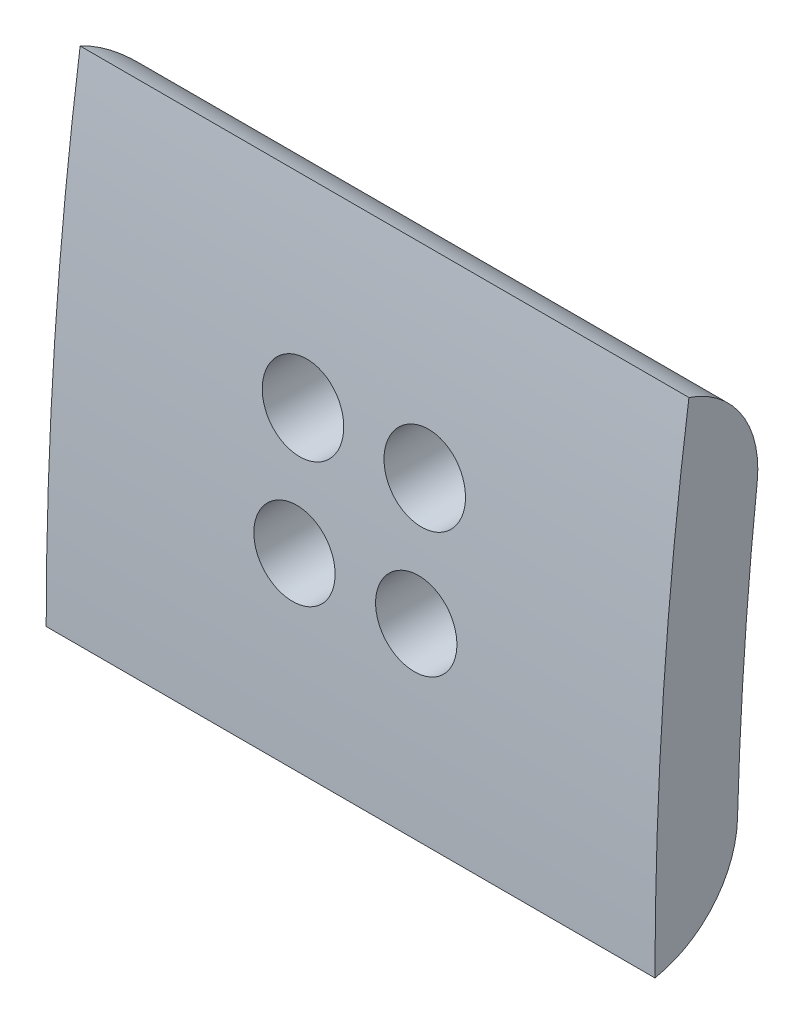
from build123d import *

# Parameters (mm, degrees)
SALIENTE_EXTRUIR1_DEPTH = 30
REDONDEO1_R             = 5
CROQUIS2_R              = 2
CORTAR_EXTRUIR1_DEPTH   = 41.197257902


with BuildPart() as part:
    # Croquis1 → Saliente-Extruir1 (new body)
    with BuildSketch(Plane(origin=(0, 0, 0), x_dir=(0, 0, -1), z_dir=(1, 0, 0))):
        with BuildLine():
            Line((-172, 0), (-168, 0))
            ThreePointArc((-168, 0), (-167.590760444, 11.719087589), (-166.365035549, 23.381080961))
            Line((-166.365035549, 23.381080961), (-170.326107824, 23.937773365))
            ThreePointArc((-170.326107824, 23.937773365), (-171.581016645, 11.998113484), (-172, 0))
        make_face()
    extrude(amount=SALIENTE_EXTRUIR1_DEPTH)

    # Redondeo1
    # the kernel refuses this fillet: 5 mm, written as the material it takes off along each edge
    with BuildSketch(Plane(origin=(-11.928000159, 0, 168), x_dir=(0, 0, 1), z_dir=(1, 0, 0))) as redondeo1_piece_1:
        with BuildLine():
            CenterArc((4.930232558, -4.912704692), REDONDEO1_R, 100.722152416, 77.650592735)
            Line((-0.067751042, -4.770719007), (-0.167710714, -4.767879293))
            ThreePointArc((-0.167710714, -4.767879293), (-0.116928532, -2.384180032), (-0.1, 0))
            Line((-0.1, 0), (0, 0.1))
            ThreePointArc((0, 0.1), (2, 0.1), (3.981395349, 0.098254094))
            Line((3.981395349, 0.098254094), (4, 0))
        make_face()
    redondeo1_piece_1_solid = extrude(amount=53.856000318, mode=Mode.PRIVATE)
    with BuildSketch(Plane(origin=(0, 0, 0), x_dir=(0, -0.07283715429145175, 0.9973438469027236), z_dir=(0, -0.9973438469027236, -0.07283715429145175))) as redondeo1_piece_2:
        with BuildLine():
            CenterArc((173, -4.898979486), REDONDEO1_R, 101.536959033, 78.463040967)
            Line((172, 0), (171.98, 0.09797959))
            ThreePointArc((171.98, 0.09797959), (170, 0.1), (168, 0.1))
            Line((168, 0.1), (167.9, 0))
            Line((167.9, 0), (167.9, -4.898979486))
            Line((167.9, -4.898979486), (168, -4.898979486))
        make_face()
    redondeo1_piece_2_solid = revolve(axis=Axis((0, 0, 0), (-1, 0, 0)), revolution_arc=16.353920807, mode=Mode.PRIVATE)
    with BuildSketch(Plane(origin=(-11.928000159, 23.381080961, 166.365035549), x_dir=(0, -0.9921444829388189, 0.12509726205662378), z_dir=(1, 0, 0))) as redondeo1_piece_3:
        with BuildLine():
            CenterArc((4.842200065, -4.999495875), REDONDEO1_R, 90.813627425, 77.650592735)
            Line((-0.056800001, -3.9995967), (-0.154780002, -3.979598716))
            ThreePointArc((-0.154780002, -3.979598716), (-0.128389918, -1.99837835), (-0.099989917, 0.00142))
            Line((-0.099989917, 0.00142), (0.00142, 0.099989917))
            ThreePointArc((0.00142, 0.099989917), (2.385600032, 0.083061386), (4.769780064, 0.099989917))
            Line((4.769780064, 0.099989917), (4.771200064, 0))
        make_face()
    redondeo1_piece_3_solid = extrude(amount=53.856000318, mode=Mode.PRIVATE)
    add([redondeo1_piece_1_solid, redondeo1_piece_2_solid, redondeo1_piece_3_solid], mode=Mode.SUBTRACT)

    # Croquis2 → Cortar-Extruir1 (cut, through all)
    with BuildSketch(Plane.XY.offset(160.05)):
        with Locations(Location((18, 15, 0), (0, 0, 180))):
            Circle(CROQUIS2_R)
        with Locations(Location((12, 15, 0), (0, 0, 180))):
            Circle(CROQUIS2_R)
        with Locations(Location((18, 9, 0), (0, 0, 180))):
            Circle(CROQUIS2_R)
        with Locations(Location((12, 9, 0), (0, 0, 180))):
            Circle(CROQUIS2_R)
    extrude(amount=CORTAR_EXTRUIR1_DEPTH, mode=Mode.SUBTRACT)


solid = part.part
